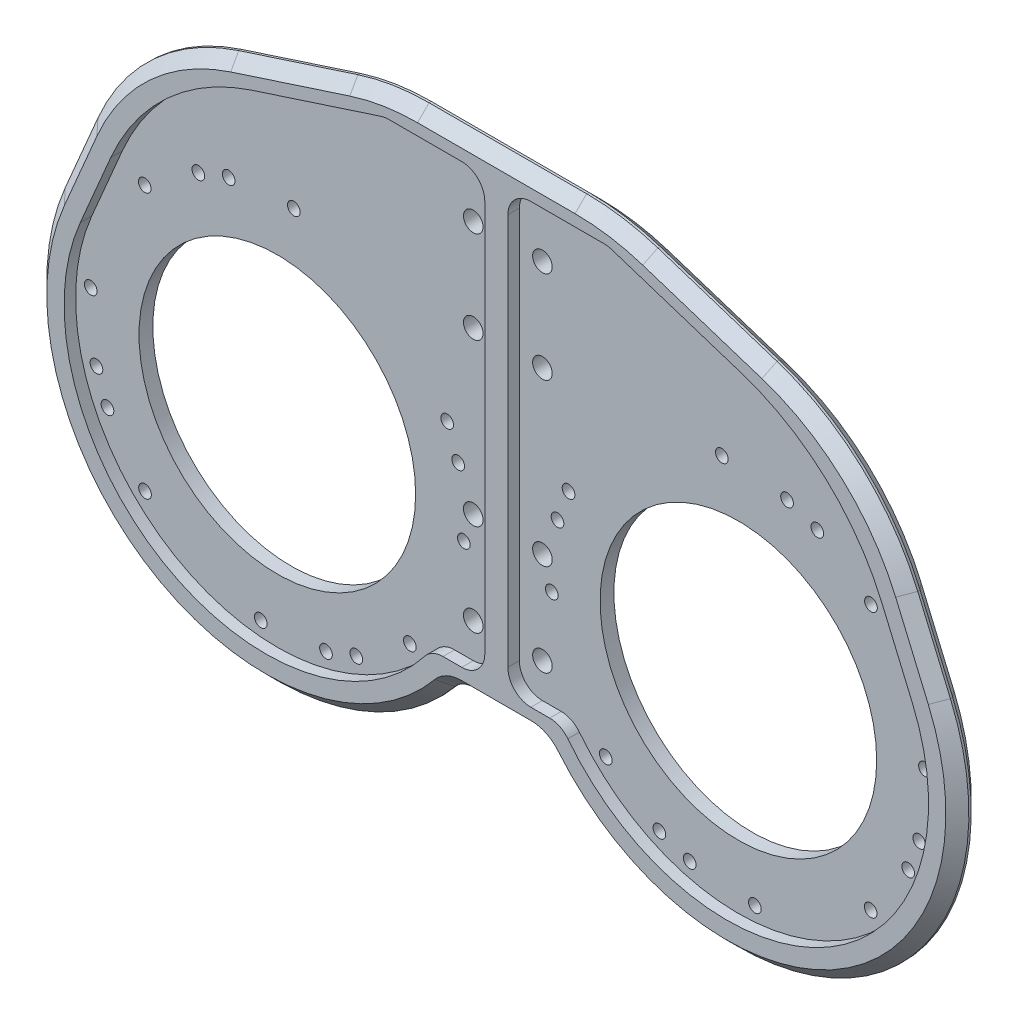
from build123d import *

# Parameters (mm, degrees)
SKETCH_1_R          = 60
EXTRUDE_1_DEPTH     = 6
FILLET_1_R          = 100
CUT_EXTRUDE_4_DEPTH = 10
CUT_EXTRUDE_5_DEPTH = 83
FILLET_2_R          = 10
FILLET_3_R          = 100
SKETCH_8_R          = 4.25
CUT_EXTRUDE_6_DEPTH = 10
EXTRUDE_2_DEPTH     = 5
SKETCH_15_R         = 2.75
CUT_EXTRUDE_8_DEPTH = 48.5
FILLET_5_R          = 10
FILLET_6_R          = 100
CHAMFER_2_SIZE      = 5


with BuildPart() as part:
    # 草图1 → 凸台-拉伸1 (new body)
    with BuildSketch(Plane.XY):
        Polygon((0, 0), (-100, 0), (-869.420884294, 0), (-100, 250), (0, 250), (769.420884294, 0), align=None)
        with Locations((50, 100)):
            Circle(SKETCH_1_R, mode=Mode.SUBTRACT)
        with Locations((-150, 100)):
            Circle(SKETCH_1_R, mode=Mode.SUBTRACT)
    extrude(amount=EXTRUDE_1_DEPTH)

    # 圆角1
    fillet_1_edges = [part.edges().sort_by_distance(p)[0] for p in [
        (-869.420884294, 0, 3),
        (769.420884294, 0, 3),
    ]]
    fillet(fillet_1_edges, radius=FILLET_1_R)

    # 草图6 → 切除-拉伸4 (cut)
    with BuildSketch(Plane.XY.offset(6)):
        with BuildLine():
            Line((-70, 40), (-30, 40))
            ThreePointArc((-30, 40), (5.27864045, 10.5572809), (50, 0))
            Line((50, 0), (-150, 0))
            ThreePointArc((-150, 0), (-105.27864045, 10.5572809), (-70, 40))
        make_face()
    extrude(amount=-CUT_EXTRUDE_4_DEPTH, mode=Mode.SUBTRACT)

    # 草图7 → 切除-拉伸5 (cut)
    with BuildSketch(Plane.XY.offset(6)):
        with BuildLine():
            Line((-241.990454949, 139.214234639), (-210, 214.258833414))
            Line((-210, 214.258833414), (-268.947432264, 195.10565163))
            ThreePointArc((-268.947432264, 195.10565163), (-336.814566886, 84.356553496), (-238.045732826, 0))
            Line((-238.045732826, 0), (-150, 0))
            ThreePointArc((-150, 0), (-233.430879966, 44.870259677), (-241.990454949, 139.214234639))
        make_face()
        with BuildLine():
            Line((110, 214.258833414), (168.947432264, 195.10565163))
            ThreePointArc((168.947432264, 195.10565163), (236.814566886, 84.356553496), (138.045732826, 0))
            Line((138.045732826, 0), (50, 0))
            ThreePointArc((50, 0), (133.430879966, 44.870259677), (141.990454949, 139.214234639))
            Line((141.990454949, 139.214234639), (110, 214.258833414))
        make_face()
    extrude(amount=-CUT_EXTRUDE_5_DEPTH, mode=Mode.SUBTRACT)

    # 圆角2
    fillet_2_edges = [part.edges().sort_by_distance(p)[0] for p in [
        (-30, 40, 3),
        (-70, 40, 3),
    ]]
    fillet(fillet_2_edges, radius=FILLET_2_R)

    # 圆角3
    fillet_3_edges = [part.edges().sort_by_distance(p)[0] for p in [
        (-100, 250, 3),
        (0, 250, 3),
        (-210, 214.258833414, 3),
        (110, 214.258833414, 3),
    ]]
    fillet(fillet_3_edges, radius=FILLET_3_R)

    # 草图8 → 切除-拉伸6 (cut)
    with BuildSketch(Plane.XY.offset(6)):
        with Locations((-35, 65)):
            Circle(SKETCH_8_R)
        with Locations((-35, 105)):
            Circle(SKETCH_8_R)
        with Locations((-35, 175)):
            Circle(SKETCH_8_R)
        with Locations((-35, 215)):
            Circle(SKETCH_8_R)
        with Locations((-65, 215)):
            Circle(SKETCH_8_R)
        with Locations((-65, 175)):
            Circle(SKETCH_8_R)
        with Locations((-65, 105)):
            Circle(SKETCH_8_R)
        with Locations((-65, 65)):
            Circle(SKETCH_8_R)
    extrude(amount=-CUT_EXTRUDE_6_DEPTH, mode=Mode.SUBTRACT)

    # 草图9 → 凸台-拉伸2 (add)
    with BuildSketch(Plane.XY.offset(6)):
        with BuildLine():
            Line((141.990454949, 139.214234639), (127.834654711, 172.421525717))
            ThreePointArc((127.834654711, 172.421525717), (103.346666574, 206.986807031), (66.7458992, 228.312942707))
            Line((66.7458992, 228.312942707), (15.063255405, 245.10565163))
            ThreePointArc((15.063255405, 245.10565163), (-0.194997528, 248.76883406), (-15.838444032, 250))
            Line((-15.838444032, 250), (-84.161555968, 250))
            ThreePointArc((-84.161555968, 250), (-99.805002472, 248.76883406), (-115.063255405, 245.10565163))
            Line((-115.063255405, 245.10565163), (-166.7458992, 228.312942707))
            ThreePointArc((-166.7458992, 228.312942707), (-203.346666574, 206.986807031), (-227.834654711, 172.421525717))
            Line((-227.834654711, 172.421525717), (-241.990454949, 139.214234639))
            ThreePointArc((-241.990454949, 139.214234639), (-201.958670135, 14.558226857), (-72.861078416, 36.363636364))
            ThreePointArc((-72.861078416, 36.363636364), (-69.411200585, 39.045340337), (-65.147186258, 40))
            Line((-65.147186258, 40), (-34.852813742, 40))
            ThreePointArc((-34.852813742, 40), (-30.588799415, 39.045340337), (-27.138921584, 36.363636364))
            ThreePointArc((-27.138921584, 36.363636364), (101.958670135, 14.558226857), (141.990454949, 139.214234639))
        make_face()
        with BuildLine():
            Line((-45, 50), (-21.807033082, 50))
            ThreePointArc((-21.807033082, 50), (92.379277536, 23.447750944), (130.49164808, 134.312455309))
            Line((130.49164808, 134.312455309), (99.429805152, 207.178675671))
            Line((99.429805152, 207.178675671), (-1.583844403, 240))
            Line((-1.583844403, 240), (-45, 240))
            Line((-45, 240), (-45, 50))
        make_face(mode=Mode.SUBTRACT)
        with BuildLine():
            Line((-55, 240), (-55, 50))
            Line((-55, 50), (-78.192966918, 50))
            ThreePointArc((-78.192966918, 50), (-192.379277536, 23.447750944), (-230.49164808, 134.312455309))
            Line((-230.49164808, 134.312455309), (-199.429805152, 207.178675671))
            Line((-199.429805152, 207.178675671), (-98.416155597, 240))
            Line((-98.416155597, 240), (-55, 240))
        make_face(mode=Mode.SUBTRACT)
    extrude(amount=EXTRUDE_2_DEPTH)

    # 草图15 → 切除-拉伸8 (cut)
    with BuildSketch(Plane.XY.offset(6)):
        with Locations((42.833838772, 180.933359212)):
            Circle(SKETCH_15_R)
        with Locations((71.111221476, 178.459408791)):
            Circle(SKETCH_15_R)
        with Locations((84.260601935, 173.673425705)):
            Circle(SKETCH_15_R)
        with Locations((107.512558498, 157.392230441)):
            Circle(SKETCH_15_R)
        with Locations((107.392230441, 42.487441502)):
            Circle(SKETCH_15_R)
        with Locations((123.673425705, 65.739398065)):
            Circle(SKETCH_15_R)
        with Locations((128.459408791, 78.888778524)):
            Circle(SKETCH_15_R)
        with Locations((130.933359212, 107.166161228)):
            Circle(SKETCH_15_R)
        with Locations((-7.512558498, 42.607769559)):
            Circle(SKETCH_15_R)
        with Locations((15.739398065, 26.326574295)):
            Circle(SKETCH_15_R)
        with Locations((28.888778524, 21.540591209)):
            Circle(SKETCH_15_R)
        with Locations((57.166161228, 19.066640788)):
            Circle(SKETCH_15_R)
        with Locations((-23.673425705, 134.260601935)):
            Circle(SKETCH_15_R)
        with Locations((-28.459408791, 121.111221476)):
            Circle(SKETCH_15_R)
        with Locations((-30.933359212, 92.833838772)):
            Circle(SKETCH_15_R)
        with Locations((-69.066640788, 92.833838772)):
            Circle(SKETCH_15_R)
        with Locations((-71.540591209, 121.111221476)):
            Circle(SKETCH_15_R)
        with Locations((-76.326574295, 134.260601935)):
            Circle(SKETCH_15_R)
        with Locations((-157.166161228, 19.066640788)):
            Circle(SKETCH_15_R)
        with Locations((-128.888778524, 21.540591209)):
            Circle(SKETCH_15_R)
        with Locations((-115.739398065, 26.326574295)):
            Circle(SKETCH_15_R)
        with Locations((-92.487441502, 42.607769559)):
            Circle(SKETCH_15_R)
        with Locations((-230.933359212, 107.166161228)):
            Circle(SKETCH_15_R)
        with Locations((-228.459408791, 78.888778524)):
            Circle(SKETCH_15_R)
        with Locations((-223.673425705, 65.739398065)):
            Circle(SKETCH_15_R)
        with Locations((-207.392230441, 42.487441502)):
            Circle(SKETCH_15_R)
        with Locations((-207.512558498, 157.392230441)):
            Circle(SKETCH_15_R)
        with Locations((-184.260601935, 173.673425705)):
            Circle(SKETCH_15_R)
        with Locations((-171.111221476, 178.459408791)):
            Circle(SKETCH_15_R)
        with Locations((-142.833838772, 180.933359212)):
            Circle(SKETCH_15_R)
    extrude(amount=-CUT_EXTRUDE_8_DEPTH, mode=Mode.SUBTRACT)

    # 圆角5
    fillet_5_edges = [part.edges().sort_by_distance(p)[0] for p in [
        (-1.583844403, 240, 8.5),
        (-45, 240, 8.5),
        (-45, 50, 8.5),
        (-21.807033082, 50, 8.5),
        (-78.192966918, 50, 8.5),
        (-55, 50, 8.5),
        (-55, 240, 8.5),
        (-98.416155597, 240, 8.5),
    ]]
    fillet(fillet_5_edges, radius=FILLET_5_R)

    # 圆角6
    fillet_6_edges = [part.edges().sort_by_distance(p)[0] for p in [
        (99.429805152, 207.178675671, 8.5),
        (-199.429805152, 207.178675671, 8.5),
    ]]
    fillet(fillet_6_edges, radius=FILLET_6_R)

    # 倒角2
    chamfer_2_edges = [part.edges().sort_by_distance(p)[0] for p in [
        (-50, 40, 0),
        (-201.958670135, 14.558226857, 0),
        (-30.588799415, 39.045340337, 0),
        (-69.411200585, 39.045340337, 0),
        (134.91255483, 155.817880178, 0),
        (40.904577302, 236.709297168, 0),
        (-140.904577302, 236.709297168, 0),
        (-50, 250, 0),
        (-203.346666574, 206.986807031, 0),
        (-99.805002472, 248.76883406, 0),
        (-0.194997528, 248.76883406, 0),
        (103.346666574, 206.986807031, 0),
        (101.958670135, 14.558226857, 11),
        (134.91255483, 155.817880178, 11),
        (103.346666574, 206.986807031, 11),
        (40.904577302, 236.709297168, 11),
        (-0.194997528, 248.76883406, 11),
        (-50, 250, 11),
        (-99.805002472, 248.76883406, 11),
        (-140.904577302, 236.709297168, 11),
        (-203.346666574, 206.986807031, 11),
        (-234.91255483, 155.817880178, 11),
        (-201.958670135, 14.558226857, 11),
        (-69.411200585, 39.045340337, 11),
        (-50, 40, 11),
        (-30.588799415, 39.045340337, 11),
        (101.958670135, 14.558226857, 0),
        (-234.91255483, 155.817880178, 0),
    ]]
    chamfer(chamfer_2_edges, length=CHAMFER_2_SIZE - 0.0001)  # a hair under: the kernel refuses the full size


solid = part.part
